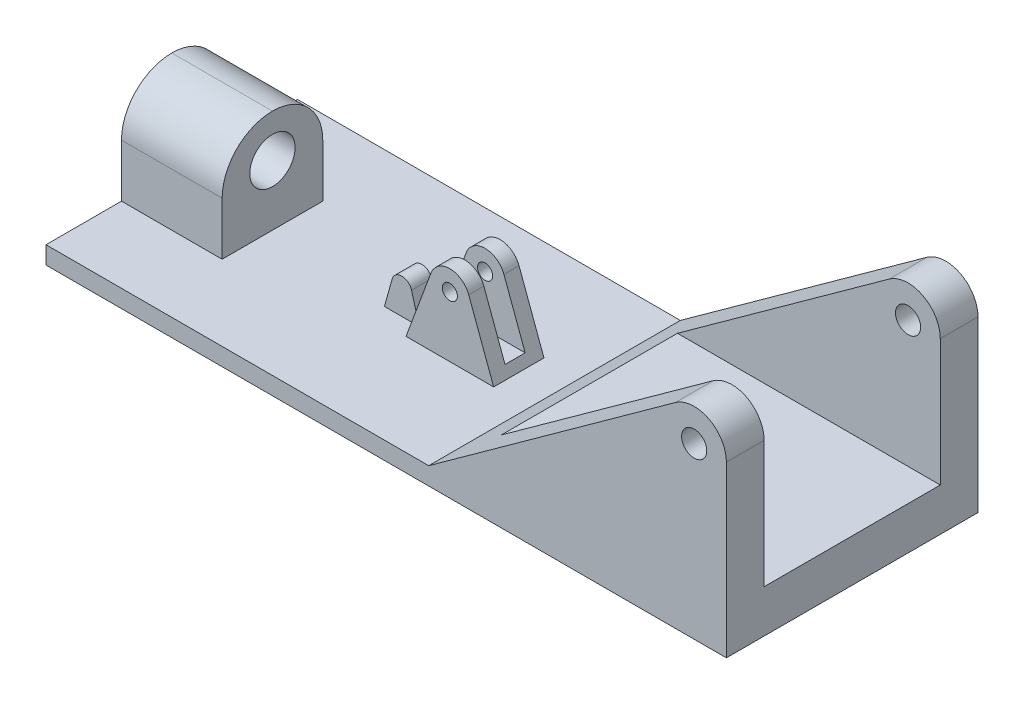
from build123d import *

# Parameters (mm, degrees)
SKETCH1_W           = 171.704
SKETCH1_H           = 4.445
BASE_EXTRUDE_DEPTH  = 31.75
SKETCH4_W           = 25.4
SKETCH4_H           = 30.48
BOSS_EXTRUDE3_DEPTH = 12.7
SKETCH5_R           = 5.715
CUT_EXTRUDE1_DEPTH  = 160.803312245
SKETCH3_R           = 1.905
BOSS_EXTRUDE1_DEPTH = 6.35
SKETCH2_R           = 3.175
BOSS_EXTRUDE2_DEPTH = 31.75
FILLET1_R           = 12.7
CUT_EXTRUDE2_DEPTH  = 2.54
CUT_EXTRUDE4_DEPTH  = 22.225
BOSS_EXTRUDE4_DEPTH = 2.54


with BuildPart() as part:
    # Sketch1 → Base-Extrude (new, symmetric)
    with BuildSketch(Plane.XY):
        with Locations((-59.590145552, 27.636826085)):
            Rectangle(SKETCH1_W, SKETCH1_H)
    extrude(amount=BASE_EXTRUDE_DEPTH, both=True)

    # Sketch4 → Boss-Extrude3 (add, symmetric)
    with BuildSketch(Plane.XY):
        with Locations((-132.742145552, 40.654326085)):
            Rectangle(SKETCH4_W, SKETCH4_H)
    extrude(amount=BOSS_EXTRUDE3_DEPTH, both=True)

    # Sketch5 → Cut-Extrude1 (cut, through all)
    with BuildSketch(Plane(origin=(-120.042145552, 0, 0), x_dir=(0, 0, -1), z_dir=(1, 0, 0))):
        with Locations((0, 45.096262506)):
            Circle(SKETCH5_R)
    extrude(amount=-CUT_EXTRUDE1_DEPTH, mode=Mode.SUBTRACT)

    # Sketch3 → Boss-Extrude1 (add, symmetric)
    with BuildSketch(Plane.XY):
        with BuildLine():
            Line((-81.627185552, 25.414326085), (-56.227185552, 25.414326085))
            Line((-56.227185552, 25.414326085), (-64.162927469, 46.859284036))
            ThreePointArc((-64.162927469, 46.859284036), (-68.927185552, 50.176262506), (-73.691443636, 46.859284036))
            Line((-73.691443636, 46.859284036), (-81.627185552, 25.414326085))
        make_face()
        with Locations((-68.927185552, 45.096262506)):
            Circle(SKETCH3_R, mode=Mode.SUBTRACT)
    extrude(amount=BOSS_EXTRUDE1_DEPTH, both=True)

    # Sketch2 → Boss-Extrude2 (add, symmetric)
    with BuildSketch(Plane.XY):
        with BuildLine():
            Line((-55.018145552, 25.414326085), (26.261854448, 25.414326085))
            Line((26.261854448, 25.414326085), (26.261854448, 68.187926085))
            ThreePointArc((26.261854448, 68.187926085), (21.835266898, 75.424218635), (13.377029184, 74.77860112))
            Line((13.377029184, 74.77860112), (-55.018145552, 25.414326085))
        make_face()
        with Locations((18.133854448, 68.187926085)):
            Circle(SKETCH2_R, mode=Mode.SUBTRACT)
    extrude(amount=BOSS_EXTRUDE2_DEPTH, both=True)

    # Fillet1
    fillet1_edges = [part.edges().sort_by_distance(p)[0] for p in [
        (-132.742145552, 55.894326085, 12.7),
        (-132.742145552, 55.894326085, -12.7),
    ]]
    fillet(fillet1_edges, radius=FILLET1_R - 0.0001)  # a hair under: the kernel refuses the full size

    # Sketch6 → Cut-Extrude2 (cut, symmetric)
    with BuildSketch(Plane.XY):
        with BuildLine():
            Line((-79.042374828, 32.399326085), (-58.811996277, 32.399326085))
            Line((-58.811996277, 32.399326085), (-64.162927469, 46.859284036))
            ThreePointArc((-64.162927469, 46.859284036), (-68.927185552, 50.176262506), (-73.691443636, 46.859284036))
            Line((-73.691443636, 46.859284036), (-79.042374828, 32.399326085))
        make_face()
    extrude(amount=CUT_EXTRUDE2_DEPTH, both=True, mode=Mode.SUBTRACT)

    # Sketch7 → Cut-Extrude4 (cut, symmetric)
    with BuildSketch(Plane.XY):
        with BuildLine():
            Line((13.377029184, 74.77860112), (-40.061460566, 36.209326085))
            Line((-40.061460566, 36.209326085), (26.261854448, 36.209326085))
            Line((26.261854448, 36.209326085), (26.261854448, 68.187926085))
            ThreePointArc((26.261854448, 68.187926085), (21.835266898, 75.424218635), (13.377029184, 74.77860112))
        make_face()
    extrude(amount=CUT_EXTRUDE4_DEPTH, both=True, mode=Mode.SUBTRACT)

    # Sketch8 → Boss-Extrude4 (add, symmetric)
    with BuildSketch(Plane.XY):
        with BuildLine():
            Line((-90.484109136, 25.414326085), (-79.221861969, 25.414326085))
            Line((-79.221861969, 25.414326085), (-82.40622809, 36.840418981))
            ThreePointArc((-82.40622809, 36.840418981), (-84.852985552, 38.698526085), (-87.299743015, 36.840418981))
            Line((-87.299743015, 36.840418981), (-90.484109136, 25.414326085))
        make_face()
    extrude(amount=BOSS_EXTRUDE4_DEPTH, both=True)


solid = part.part
